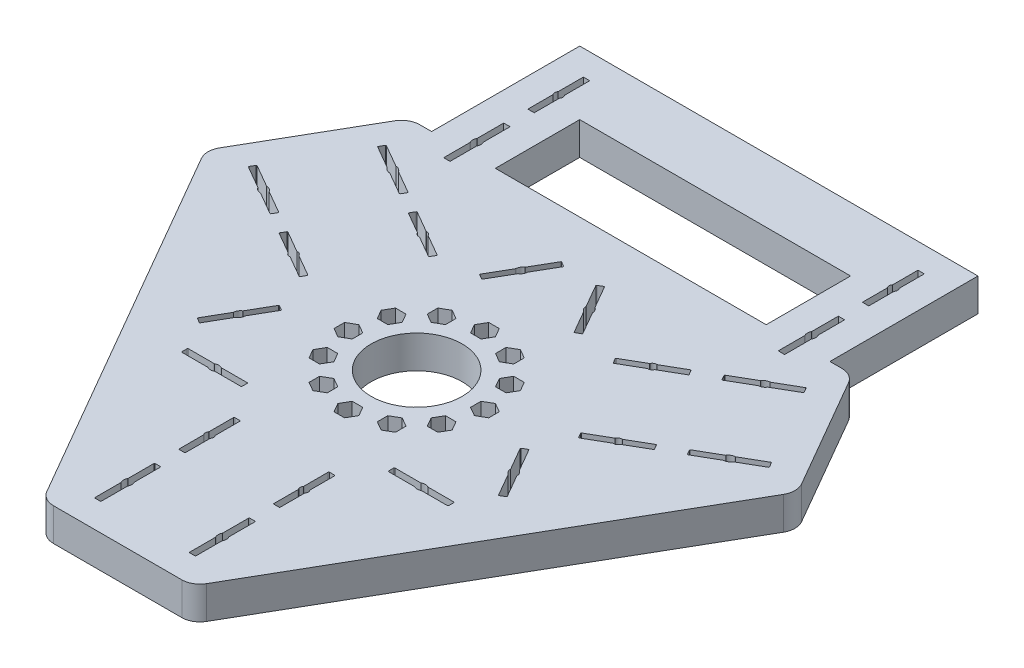
from build123d import *

# Parameters (mm, degrees)
SKETCH1_R           = 25
BOSS_EXTRUDE1_DEPTH = 18
CUT_EXTRUDE1_DEPTH  = 18
CIRPATTERN1_DEPTH   = 18
CUT_EXTRUDE2_DEPTH  = 232.935325069
FILLET1_R           = 10
BOSS_EXTRUDE2_DEPTH = 18
SKETCH4_3_W         = 3.5
SKETCH4_3_H         = 9.137041555
CUT_EXTRUDE3_DEPTH  = 18


# Read off the part's stored shape, not the designer's step: CirPattern1
with BuildPart() as part:
    # Sketch1 → Boss-Extrude1 (new body)
    # profile 1 of 4: a face of its own
    with BuildSketch(Plane(origin=(0, 0, 0), x_dir=(1, 0, 0), z_dir=(0, 1, 0))):
        Polygon((-41, -164.26), (0, -164.26), (41, -164.26), (101.876666413, -58.818520778), (162.753332826, 46.622958445), (142.253332826, 82.13), (121.753332826, 117.637041555), (-121.753332826, 117.637041555), (-142.253332826, 82.13), (-162.753332826, 46.622958445), align=None)
        with BuildLine():
            ThreePointArc((24.25, -116.61), (24.352512627, -116.362512627), (24.6, -116.26))
            Line((24.6, -116.26), (27.4, -116.26))
            ThreePointArc((27.4, -116.26), (27.647487373, -116.362512627), (27.75, -116.61))
            Line((27.75, -116.61), (27.75, -130.779459534))
            ThreePointArc((27.75, -130.779459534), (27.76155644, -130.868655705), (27.795462611, -130.951961647))
            add(Edge.make_bspline(
                [(27.795462611, -134.568038353), (28.819607586, -132.76), (27.795462611, -130.951961647)],
                knots=[4.065534334, 4.065534334, 4.065534334, 5.359243627, 5.359243627, 5.359243627], degree=2, weights=[1, 0.797983383, 1]))
            ThreePointArc((27.795462611, -134.568038353), (27.76155644, -134.651344295), (27.75, -134.740540466))
            Line((27.75, -134.740540466), (27.75, -148.91))
            ThreePointArc((27.75, -148.91), (27.647487373, -149.157487373), (27.4, -149.26))
            Line((27.4, -149.26), (24.6, -149.26))
            ThreePointArc((24.6, -149.26), (24.352512627, -149.157487373), (24.25, -148.91))
            Line((24.25, -148.91), (24.25, -134.740540466))
            ThreePointArc((24.25, -134.740540466), (24.23844356, -134.651344295), (24.204537389, -134.568038353))
            add(Edge.make_bspline(
                [(24.204537389, -130.951961647), (23.180392414, -132.76), (24.204537389, -134.568038353)],
                knots=[0.923941681, 0.923941681, 0.923941681, 2.217650973, 2.217650973, 2.217650973], degree=2, weights=[1, 0.797983383, 1]))
            ThreePointArc((24.204537389, -130.951961647), (24.23844356, -130.868655705), (24.25, -130.779459534))
            Line((24.25, -130.779459534), (24.25, -116.61))
        make_face(mode=Mode.SUBTRACT)
        with BuildLine():
            ThreePointArc((24.25, -72.86), (24.352512627, -72.612512627), (24.6, -72.51))
            Line((24.6, -72.51), (27.4, -72.51))
            ThreePointArc((27.4, -72.51), (27.647487373, -72.612512627), (27.75, -72.86))
            Line((27.75, -72.86), (27.75, -86.227029028))
            ThreePointArc((27.75, -86.227029028), (27.767252117, -86.335559421), (27.817307692, -86.433390505))
            ThreePointArc((27.817307692, -86.433390505), (28.25, -87.76), (27.817307692, -89.086609495))
            ThreePointArc((27.817307692, -89.086609495), (27.767252117, -89.184440579), (27.75, -89.292970972))
            Line((27.75, -89.292970972), (27.75, -102.66))
            ThreePointArc((27.75, -102.66), (27.647487373, -102.907487373), (27.4, -103.01))
            Line((27.4, -103.01), (24.6, -103.01))
            ThreePointArc((24.6, -103.01), (24.352512627, -102.907487373), (24.25, -102.66))
            Line((24.25, -102.66), (24.25, -89.292970972))
            ThreePointArc((24.25, -89.292970972), (24.232747883, -89.184440579), (24.182692308, -89.086609495))
            ThreePointArc((24.182692308, -89.086609495), (23.75, -87.76), (24.182692308, -86.433390505))
            ThreePointArc((24.182692308, -86.433390505), (24.232747883, -86.335559421), (24.25, -86.227029028))
            Line((24.25, -86.227029028), (24.25, -72.86))
        make_face(mode=Mode.SUBTRACT)
        with BuildLine():
            Line((72.9, -56), (58.730540466, -56))
            ThreePointArc((58.730540466, -56), (58.641344295, -56.01155644), (58.558038353, -56.045462611))
            add(Edge.make_bspline(
                [(54.941961647, -56.045462611), (56.75, -57.069607586), (58.558038353, -56.045462611)],
                knots=[4.065534334, 4.065534334, 4.065534334, 5.359243627, 5.359243627, 5.359243627], degree=2, weights=[1, 0.797983383, 1]))
            ThreePointArc((54.941961647, -56.045462611), (54.858655705, -56.01155644), (54.769459534, -56))
            Line((54.769459534, -56), (40.6, -56))
            ThreePointArc((40.6, -56), (40.352512627, -55.897487373), (40.25, -55.65))
            Line((40.25, -55.65), (40.25, -52.85))
            ThreePointArc((40.25, -52.85), (40.352512627, -52.602512627), (40.6, -52.5))
            Line((40.6, -52.5), (54.769459534, -52.5))
            ThreePointArc((54.769459534, -52.5), (54.858655705, -52.48844356), (54.941961647, -52.454537389))
            add(Edge.make_bspline(
                [(58.558038353, -52.454537389), (56.75, -51.430392414), (54.941961647, -52.454537389)],
                knots=[0.923941681, 0.923941681, 0.923941681, 2.217650973, 2.217650973, 2.217650973], degree=2, weights=[1, 0.797983383, 1]))
            ThreePointArc((58.558038353, -52.454537389), (58.641344295, -52.48844356), (58.730540466, -52.5))
            Line((58.730540466, -52.5), (72.9, -52.5))
            ThreePointArc((72.9, -52.5), (73.147487373, -52.602512627), (73.25, -52.85))
            Line((73.25, -52.85), (73.25, -55.65))
            ThreePointArc((73.25, -55.65), (73.147487373, -55.897487373), (72.9, -56))
        make_face(mode=Mode.SUBTRACT)
        with Locations(Location((0, 0, 0), (0, 0, 270))):
            Circle(SKETCH1_R, mode=Mode.SUBTRACT)
    # profile 2 of 4: a face of its own
    with BuildSketch(Plane(origin=(0, 0, 0), x_dir=(1, 0, 0), z_dir=(0, 1, 0))):
        with BuildLine():
            ThreePointArc((27.75, -86.227029028), (27.767252117, -86.335559421), (27.817307692, -86.433390505))
            ThreePointArc((27.817307692, -86.433390505), (28.25, -87.76), (27.817307692, -89.086609495))
            ThreePointArc((27.817307692, -89.086609495), (27.767252117, -89.184440579), (27.75, -89.292970972))
            Line((27.75, -89.292970972), (27.75, -102.66))
            ThreePointArc((27.75, -102.66), (27.647487373, -102.907487373), (27.4, -103.01))
            Line((27.4, -103.01), (24.6, -103.01))
            ThreePointArc((24.6, -103.01), (24.352512627, -102.907487373), (24.25, -102.66))
            Line((24.25, -102.66), (24.25, -89.292970972))
            ThreePointArc((24.25, -89.292970972), (24.232747883, -89.184440579), (24.182692308, -89.086609495))
            ThreePointArc((24.182692308, -89.086609495), (23.75, -87.76), (24.182692308, -86.433390505))
            ThreePointArc((24.182692308, -86.433390505), (24.232747883, -86.335559421), (24.25, -86.227029028))
            Line((24.25, -86.227029028), (24.25, -72.86))
            ThreePointArc((24.25, -72.86), (24.352512627, -72.612512627), (24.6, -72.51))
            Line((24.6, -72.51), (27.4, -72.51))
            ThreePointArc((27.4, -72.51), (27.647487373, -72.612512627), (27.75, -72.86))
            Line((27.75, -72.86), (27.75, -86.227029028))
        make_face()
    # profile 3 of 4: a face of its own
    with BuildSketch(Plane(origin=(0, 0, 0), x_dir=(1, 0, 0), z_dir=(0, 1, 0))):
        with BuildLine():
            ThreePointArc((24.25, -130.779459534), (24.23844356, -130.868655705), (24.204537389, -130.951961647))
            add(Edge.make_bspline(
                [(24.204537389, -130.951961647), (23.180392414, -132.76), (24.204537389, -134.568038353)],
                knots=[0.923941681, 0.923941681, 0.923941681, 2.217650973, 2.217650973, 2.217650973], degree=2, weights=[1, 0.797983383, 1]))
            ThreePointArc((24.204537389, -134.568038353), (24.23844356, -134.651344295), (24.25, -134.740540466))
            Line((24.25, -134.740540466), (24.25, -148.91))
            ThreePointArc((24.25, -148.91), (24.352512627, -149.157487373), (24.6, -149.26))
            Line((24.6, -149.26), (27.4, -149.26))
            ThreePointArc((27.4, -149.26), (27.647487373, -149.157487373), (27.75, -148.91))
            Line((27.75, -148.91), (27.75, -134.740540466))
            ThreePointArc((27.75, -134.740540466), (27.76155644, -134.651344295), (27.795462611, -134.568038353))
            add(Edge.make_bspline(
                [(27.795462611, -134.568038353), (28.819607586, -132.76), (27.795462611, -130.951961647)],
                knots=[4.065534334, 4.065534334, 4.065534334, 5.359243627, 5.359243627, 5.359243627], degree=2, weights=[1, 0.797983383, 1]))
            ThreePointArc((27.795462611, -130.951961647), (27.76155644, -130.868655705), (27.75, -130.779459534))
            Line((27.75, -130.779459534), (27.75, -116.61))
            ThreePointArc((27.75, -116.61), (27.647487373, -116.362512627), (27.4, -116.26))
            Line((27.4, -116.26), (24.6, -116.26))
            ThreePointArc((24.6, -116.26), (24.352512627, -116.362512627), (24.25, -116.61))
            Line((24.25, -116.61), (24.25, -130.779459534))
        make_face()
    # profile 4 of 4: a face of its own
    with BuildSketch(Plane(origin=(0, 0, 0), x_dir=(1, 0, 0), z_dir=(0, 1, 0))):
        with BuildLine():
            ThreePointArc((58.558038353, -56.045462611), (58.641344295, -56.01155644), (58.730540466, -56))
            Line((58.730540466, -56), (72.9, -56))
            ThreePointArc((72.9, -56), (73.147487373, -55.897487373), (73.25, -55.65))
            Line((73.25, -55.65), (73.25, -52.85))
            ThreePointArc((73.25, -52.85), (73.147487373, -52.602512627), (72.9, -52.5))
            Line((72.9, -52.5), (58.730540466, -52.5))
            ThreePointArc((58.730540466, -52.5), (58.641344295, -52.48844356), (58.558038353, -52.454537389))
            add(Edge.make_bspline(
                [(58.558038353, -52.454537389), (56.75, -51.430392414), (54.941961647, -52.454537389)],
                knots=[0.923941681, 0.923941681, 0.923941681, 2.217650973, 2.217650973, 2.217650973], degree=2, weights=[1, 0.797983383, 1]))
            ThreePointArc((54.941961647, -52.454537389), (54.858655705, -52.48844356), (54.769459534, -52.5))
            Line((54.769459534, -52.5), (40.6, -52.5))
            ThreePointArc((40.6, -52.5), (40.352512627, -52.602512627), (40.25, -52.85))
            Line((40.25, -52.85), (40.25, -55.65))
            ThreePointArc((40.25, -55.65), (40.352512627, -55.897487373), (40.6, -56))
            Line((40.6, -56), (54.769459534, -56))
            ThreePointArc((54.769459534, -56), (54.858655705, -56.01155644), (54.941961647, -56.045462611))
            add(Edge.make_bspline(
                [(54.941961647, -56.045462611), (56.75, -57.069607586), (58.558038353, -56.045462611)],
                knots=[4.065534334, 4.065534334, 4.065534334, 5.359243627, 5.359243627, 5.359243627], degree=2, weights=[1, 0.797983383, 1]))
        make_face()
    extrude(amount=BOSS_EXTRUDE1_DEPTH)

    # Sketch1<3> → Cut-Extrude1 (cut)
    with BuildSketch(Plane(origin=(0, 0, 0), x_dir=(1, 0, 0), z_dir=(0, 1, 0))):
        with BuildLine():
            Line((24.6, -72.51), (27.4, -72.51))
            ThreePointArc((27.4, -72.51), (27.647487373, -72.612512627), (27.75, -72.86))
            Line((27.75, -72.86), (27.75, -86.227029028))
            ThreePointArc((27.75, -86.227029028), (27.767252117, -86.335559421), (27.817307692, -86.433390505))
            ThreePointArc((27.817307692, -86.433390505), (28.25, -87.76), (27.817307692, -89.086609495))
            ThreePointArc((27.817307692, -89.086609495), (27.767252117, -89.184440579), (27.75, -89.292970972))
            Line((27.75, -89.292970972), (27.75, -102.66))
            ThreePointArc((27.75, -102.66), (27.647487373, -102.907487373), (27.4, -103.01))
            Line((27.4, -103.01), (24.6, -103.01))
            ThreePointArc((24.6, -103.01), (24.352512627, -102.907487373), (24.25, -102.66))
            Line((24.25, -102.66), (24.25, -89.292970972))
            ThreePointArc((24.25, -89.292970972), (24.232747883, -89.184440579), (24.182692308, -89.086609495))
            ThreePointArc((24.182692308, -89.086609495), (23.75, -87.76), (24.182692308, -86.433390505))
            ThreePointArc((24.182692308, -86.433390505), (24.232747883, -86.335559421), (24.25, -86.227029028))
            Line((24.25, -86.227029028), (24.25, -72.86))
            ThreePointArc((24.25, -72.86), (24.352512627, -72.612512627), (24.6, -72.51))
        make_face()
        with BuildLine():
            Line((24.6, -116.26), (27.4, -116.26))
            ThreePointArc((27.4, -116.26), (27.647487373, -116.362512627), (27.75, -116.61))
            Line((27.75, -116.61), (27.75, -130.779459534))
            ThreePointArc((27.75, -130.779459534), (27.76155644, -130.868655705), (27.795462611, -130.951961647))
            add(Edge.make_bspline(
                [(27.795462611, -134.568038353), (28.819607586, -132.76), (27.795462611, -130.951961647)],
                knots=[4.065534334, 4.065534334, 4.065534334, 5.359243627, 5.359243627, 5.359243627], degree=2, weights=[1, 0.797983383, 1]))
            ThreePointArc((27.795462611, -134.568038353), (27.76155644, -134.651344295), (27.75, -134.740540466))
            Line((27.75, -134.740540466), (27.75, -148.91))
            ThreePointArc((27.75, -148.91), (27.647487373, -149.157487373), (27.4, -149.26))
            Line((27.4, -149.26), (24.6, -149.26))
            ThreePointArc((24.6, -149.26), (24.352512627, -149.157487373), (24.25, -148.91))
            Line((24.25, -148.91), (24.25, -134.740540466))
            ThreePointArc((24.25, -134.740540466), (24.23844356, -134.651344295), (24.204537389, -134.568038353))
            add(Edge.make_bspline(
                [(24.204537389, -130.951961647), (23.180392414, -132.76), (24.204537389, -134.568038353)],
                knots=[0.923941681, 0.923941681, 0.923941681, 2.217650973, 2.217650973, 2.217650973], degree=2, weights=[1, 0.797983383, 1]))
            ThreePointArc((24.204537389, -130.951961647), (24.23844356, -130.868655705), (24.25, -130.779459534))
            Line((24.25, -130.779459534), (24.25, -116.61))
            ThreePointArc((24.25, -116.61), (24.352512627, -116.362512627), (24.6, -116.26))
        make_face()
        with BuildLine():
            Line((58.730540466, -56), (72.9, -56))
            ThreePointArc((72.9, -56), (73.147487373, -55.897487373), (73.25, -55.65))
            Line((73.25, -55.65), (73.25, -52.85))
            ThreePointArc((73.25, -52.85), (73.147487373, -52.602512627), (72.9, -52.5))
            Line((72.9, -52.5), (58.730540466, -52.5))
            ThreePointArc((58.730540466, -52.5), (58.641344295, -52.48844356), (58.558038353, -52.454537389))
            add(Edge.make_bspline(
                [(58.558038353, -52.454537389), (56.75, -51.430392414), (54.941961647, -52.454537389)],
                knots=[0.923941681, 0.923941681, 0.923941681, 2.217650973, 2.217650973, 2.217650973], degree=2, weights=[1, 0.797983383, 1]))
            ThreePointArc((54.941961647, -52.454537389), (54.858655705, -52.48844356), (54.769459534, -52.5))
            Line((54.769459534, -52.5), (40.6, -52.5))
            ThreePointArc((40.6, -52.5), (40.352512627, -52.602512627), (40.25, -52.85))
            Line((40.25, -52.85), (40.25, -55.65))
            ThreePointArc((40.25, -55.65), (40.352512627, -55.897487373), (40.6, -56))
            Line((40.6, -56), (54.769459534, -56))
            ThreePointArc((54.769459534, -56), (54.858655705, -56.01155644), (54.941961647, -56.045462611))
            add(Edge.make_bspline(
                [(54.941961647, -56.045462611), (56.75, -57.069607586), (58.558038353, -56.045462611)],
                knots=[4.065534334, 4.065534334, 4.065534334, 5.359243627, 5.359243627, 5.359243627], degree=2, weights=[1, 0.797983383, 1]))
            ThreePointArc((58.558038353, -56.045462611), (58.641344295, -56.01155644), (58.730540466, -56))
        make_face()
    cut_extrude1 = extrude(amount=CUT_EXTRUDE1_DEPTH, mode=Mode.SUBTRACT)

    # Mirror1: Cut-Extrude1 across plane
    add(cut_extrude1.mirror(Plane(origin=(0, 0, 0), x_dir=(0, 0, 1), z_dir=(1, 0, 0))), mode=Mode.SUBTRACT)

    # CirPattern1 outline → CirPattern1 (cut)
    with BuildSketch(Plane(origin=(0, 0, 0), x_dir=(1, 0, 0), z_dir=(0, 1, 0))):
        with BuildLine():
            ThreePointArc((101.13333425, 86.390845809), (101.21635862, 86.425435723), (101.305456767, 86.437725089))
            add(Edge.make_bspline(
                [(101.305456767, 86.437725089), (103.3833364, 86.4548087), (104.437071057, 88.245763442)],
                knots=[0.923941681, 0.923941681, 0.923941681, 2.217650973, 2.217650973, 2.217650973], degree=2, weights=[1, 0.797983383, 1]))
            ThreePointArc((104.437071057, 88.245763442), (104.492263033, 88.316780018), (104.563730963, 88.371386275))
            Line((104.563730963, 88.371386275), (116.834842878, 95.456116042))
            ThreePointArc((116.834842878, 95.456116042), (116.997916917, 95.668638267), (116.962951769, 95.934224933))
            Line((116.962951769, 95.934224933), (115.562951769, 98.359096064))
            ThreePointArc((115.562951769, 98.359096064), (115.350429544, 98.522170103), (115.084842878, 98.487204955))
            Line((115.084842878, 98.487204955), (102.813730963, 91.402475188))
            ThreePointArc((102.813730963, 91.402475188), (102.730706592, 91.367885273), (102.641608445, 91.355595908))
            add(Edge.make_bspline(
                [(102.641608445, 91.355595908), (100.563728813, 91.338512297), (99.509994156, 89.547557555)],
                knots=[4.065534334, 4.065534334, 4.065534334, 5.359243627, 5.359243627, 5.359243627], degree=2, weights=[1, 0.797983383, 1]))
            ThreePointArc((99.509994156, 89.547557555), (99.45480218, 89.476540979), (99.38333425, 89.421934722))
            Line((99.38333425, 89.421934722), (87.112222335, 82.337204955))
            ThreePointArc((87.112222335, 82.337204955), (86.949148296, 82.12468273), (86.984113444, 81.859096064))
            Line((86.984113444, 81.859096064), (88.384113444, 79.434224933))
            ThreePointArc((88.384113444, 79.434224933), (88.596635669, 79.271150894), (88.862222335, 79.306116042))
            Line((88.862222335, 79.306116042), (101.13333425, 86.390845809))
        make_face()
        with BuildLine():
            ThreePointArc((16.101063466, 77.112140022), (16.13565338, 77.029115651), (16.147942746, 76.940017504))
            add(Edge.make_bspline(
                [(16.147942746, 76.940017504), (16.165026357, 74.862137872), (17.955981099, 73.808403214)],
                knots=[0.923941681, 0.923941681, 0.923941681, 2.217650973, 2.217650973, 2.217650973], degree=2, weights=[1, 0.797983383, 1]))
            ThreePointArc((17.955981099, 73.808403214), (18.026997675, 73.753211238), (18.081603932, 73.681743308))
            Line((18.081603932, 73.681743308), (25.166333699, 61.410631394))
            ThreePointArc((25.166333699, 61.410631394), (25.378855924, 61.247557354), (25.64444259, 61.282522502))
            Line((25.64444259, 61.282522502), (28.069313721, 62.682522502))
            ThreePointArc((28.069313721, 62.682522502), (28.23238776, 62.895044728), (28.197422612, 63.160631394))
            Line((28.197422612, 63.160631394), (21.112692845, 75.431743308))
            ThreePointArc((21.112692845, 75.431743308), (21.07810293, 75.514767679), (21.065813565, 75.603865826))
            add(Edge.make_bspline(
                [(19.257775212, 78.735480115), (21.048729954, 77.681745458), (21.065813565, 75.603865826)],
                knots=[0.923941681, 0.923941681, 0.923941681, 2.217650973, 2.217650973, 2.217650973], degree=2, weights=[1, 0.797983383, 1]))
            ThreePointArc((19.257775212, 78.735480115), (19.186758636, 78.790672091), (19.132152379, 78.862140022))
            Line((19.132152379, 78.862140022), (12.047422612, 91.133251936))
            ThreePointArc((12.047422612, 91.133251936), (11.834900387, 91.296325975), (11.569313721, 91.261360827))
            Line((11.569313721, 91.261360827), (9.14444259, 89.861360827))
            ThreePointArc((9.14444259, 89.861360827), (8.981368551, 89.648838602), (9.016333699, 89.383251936))
            Line((9.016333699, 89.383251936), (16.101063466, 77.112140022))
        make_face()
        with BuildLine():
            ThreePointArc((-125.38333425, 44.388613725), (-125.45480218, 44.443219982), (-125.509994156, 44.514236558))
            add(Edge.make_bspline(
                [(-125.509994156, 44.514236558), (-126.563728813, 46.3051913), (-128.641608445, 46.322274911)],
                knots=[0.923941681, 0.923941681, 0.923941681, 2.217650973, 2.217650973, 2.217650973], degree=2, weights=[1, 0.797983383, 1]))
            ThreePointArc((-128.641608445, 46.322274911), (-128.730706592, 46.334564277), (-128.813730963, 46.369154191))
            Line((-128.813730963, 46.369154191), (-141.084842878, 53.453883958))
            ThreePointArc((-141.084842878, 53.453883958), (-141.350429544, 53.488849106), (-141.562951769, 53.325775067))
            Line((-141.562951769, 53.325775067), (-142.962951769, 50.900903936))
            ThreePointArc((-142.962951769, 50.900903936), (-142.997916917, 50.63531727), (-142.834842878, 50.422795045))
            Line((-142.834842878, 50.422795045), (-130.563730963, 43.338065278))
            ThreePointArc((-130.563730963, 43.338065278), (-130.492263033, 43.283459021), (-130.437071057, 43.212442445))
            add(Edge.make_bspline(
                [(-130.437071057, 43.212442445), (-129.3833364, 41.421487703), (-127.305456767, 41.404404092)],
                knots=[4.065534334, 4.065534334, 4.065534334, 5.359243627, 5.359243627, 5.359243627], degree=2, weights=[1, 0.797983383, 1]))
            ThreePointArc((-127.305456767, 41.404404092), (-127.21635862, 41.392114727), (-127.13333425, 41.357524812))
            Line((-127.13333425, 41.357524812), (-114.862222335, 34.272795045))
            ThreePointArc((-114.862222335, 34.272795045), (-114.596635669, 34.237829897), (-114.384113444, 34.400903936))
            Line((-114.384113444, 34.400903936), (-112.984113444, 36.825775067))
            ThreePointArc((-112.984113444, 36.825775067), (-112.949148296, 37.091361733), (-113.112222335, 37.303883958))
            Line((-113.112222335, 37.303883958), (-125.38333425, 44.388613725))
        make_face()
        with BuildLine():
            ThreePointArc((-74.831603932, -24.612140022), (-74.776997675, -24.540672091), (-74.705981099, -24.485480115))
            add(Edge.make_bspline(
                [(-74.705981099, -24.485480115), (-72.915026357, -23.431745458), (-72.897942746, -21.353865826)],
                knots=[0.923941681, 0.923941681, 0.923941681, 2.217650973, 2.217650973, 2.217650973], degree=2, weights=[1, 0.797983383, 1]))
            ThreePointArc((-72.897942746, -21.353865826), (-72.88565338, -21.264767679), (-72.851063466, -21.181743308))
            Line((-72.851063466, -21.181743308), (-65.766333699, -8.910631394))
            ThreePointArc((-65.766333699, -8.910631394), (-65.731368551, -8.645044728), (-65.89444259, -8.432522502))
            Line((-65.89444259, -8.432522502), (-68.319313721, -7.032522502))
            ThreePointArc((-68.319313721, -7.032522502), (-68.584900387, -6.997557354), (-68.797422612, -7.160631394))
            Line((-68.797422612, -7.160631394), (-75.882152379, -19.431743308))
            ThreePointArc((-75.882152379, -19.431743308), (-75.936758636, -19.503211238), (-76.007775212, -19.558403214))
            add(Edge.make_bspline(
                [(-77.815813565, -22.690017504), (-77.798729954, -20.612137872), (-76.007775212, -19.558403214)],
                knots=[0.923941681, 0.923941681, 0.923941681, 2.217650973, 2.217650973, 2.217650973], degree=2, weights=[1, 0.797983383, 1]))
            ThreePointArc((-77.815813565, -22.690017504), (-77.82810293, -22.779115651), (-77.862692845, -22.862140022))
            Line((-77.862692845, -22.862140022), (-84.947422612, -35.133251936))
            ThreePointArc((-84.947422612, -35.133251936), (-84.98238776, -35.398838602), (-84.819313721, -35.611360827))
            Line((-84.819313721, -35.611360827), (-82.39444259, -37.011360827))
            ThreePointArc((-82.39444259, -37.011360827), (-82.128855924, -37.046325975), (-81.916333699, -36.883251936))
            Line((-81.916333699, -36.883251936), (-74.831603932, -24.612140022))
        make_face()
        with BuildLine():
            add(Edge.make_bspline(
                [(130.437071057, 43.212442445), (129.3833364, 41.421487703), (127.305456767, 41.404404092)],
                knots=[4.065534334, 4.065534334, 4.065534334, 5.359243627, 5.359243627, 5.359243627], degree=2, weights=[1, 0.797983383, 1]))
            ThreePointArc((130.437071057, 43.212442445), (130.492263033, 43.283459021), (130.563730963, 43.338065278))
            Line((130.563730963, 43.338065278), (142.834842878, 50.422795045))
            ThreePointArc((142.834842878, 50.422795045), (142.997916917, 50.63531727), (142.962951769, 50.900903936))
            Line((142.962951769, 50.900903936), (141.562951769, 53.325775067))
            ThreePointArc((141.562951769, 53.325775067), (141.350429544, 53.488849106), (141.084842878, 53.453883958))
            Line((141.084842878, 53.453883958), (128.813730963, 46.369154191))
            ThreePointArc((128.813730963, 46.369154191), (128.730706592, 46.334564277), (128.641608445, 46.322274911))
            add(Edge.make_bspline(
                [(125.509994156, 44.514236558), (126.563728813, 46.3051913), (128.641608445, 46.322274911)],
                knots=[0.923941681, 0.923941681, 0.923941681, 2.217650973, 2.217650973, 2.217650973], degree=2, weights=[1, 0.797983383, 1]))
            ThreePointArc((125.509994156, 44.514236558), (125.45480218, 44.443219982), (125.38333425, 44.388613725))
            Line((125.38333425, 44.388613725), (113.112222335, 37.303883958))
            ThreePointArc((113.112222335, 37.303883958), (112.949148296, 37.091361733), (112.984113444, 36.825775067))
            Line((112.984113444, 36.825775067), (114.384113444, 34.400903936))
            ThreePointArc((114.384113444, 34.400903936), (114.596635669, 34.237829897), (114.862222335, 34.272795045))
            Line((114.862222335, 34.272795045), (127.13333425, 41.357524812))
            ThreePointArc((127.13333425, 41.357524812), (127.21635862, 41.392114727), (127.305456767, 41.404404092))
        make_face()
        with BuildLine():
            ThreePointArc((77.862692845, -22.862140022), (77.82810293, -22.779115651), (77.815813565, -22.690017504))
            add(Edge.make_bspline(
                [(77.815813565, -22.690017504), (77.798729954, -20.612137872), (76.007775212, -19.558403214)],
                knots=[0.923941681, 0.923941681, 0.923941681, 2.217650973, 2.217650973, 2.217650973], degree=2, weights=[1, 0.797983383, 1]))
            ThreePointArc((76.007775212, -19.558403214), (75.936758636, -19.503211238), (75.882152379, -19.431743308))
            Line((75.882152379, -19.431743308), (68.797422612, -7.160631394))
            ThreePointArc((68.797422612, -7.160631394), (68.584900387, -6.997557354), (68.319313721, -7.032522502))
            Line((68.319313721, -7.032522502), (65.89444259, -8.432522502))
            ThreePointArc((65.89444259, -8.432522502), (65.731368551, -8.645044728), (65.766333699, -8.910631394))
            Line((65.766333699, -8.910631394), (72.851063466, -21.181743308))
            ThreePointArc((72.851063466, -21.181743308), (72.88565338, -21.264767679), (72.897942746, -21.353865826))
            add(Edge.make_bspline(
                [(74.705981099, -24.485480115), (72.915026357, -23.431745458), (72.897942746, -21.353865826)],
                knots=[0.923941681, 0.923941681, 0.923941681, 2.217650973, 2.217650973, 2.217650973], degree=2, weights=[1, 0.797983383, 1]))
            ThreePointArc((74.705981099, -24.485480115), (74.776997675, -24.540672091), (74.831603932, -24.612140022))
            Line((74.831603932, -24.612140022), (81.916333699, -36.883251936))
            ThreePointArc((81.916333699, -36.883251936), (82.128855924, -37.046325975), (82.39444259, -37.011360827))
            Line((82.39444259, -37.011360827), (84.819313721, -35.611360827))
            ThreePointArc((84.819313721, -35.611360827), (84.98238776, -35.398838602), (84.947422612, -35.133251936))
            Line((84.947422612, -35.133251936), (77.862692845, -22.862140022))
        make_face()
        with BuildLine():
            add(Edge.make_bspline(
                [(-102.641608445, 91.355595908), (-100.563728813, 91.338512297), (-99.509994156, 89.547557555)],
                knots=[4.065534334, 4.065534334, 4.065534334, 5.359243627, 5.359243627, 5.359243627], degree=2, weights=[1, 0.797983383, 1]))
            ThreePointArc((-102.641608445, 91.355595908), (-102.730706592, 91.367885273), (-102.813730963, 91.402475188))
            Line((-102.813730963, 91.402475188), (-115.084842878, 98.487204955))
            ThreePointArc((-115.084842878, 98.487204955), (-115.350429544, 98.522170103), (-115.562951769, 98.359096064))
            Line((-115.562951769, 98.359096064), (-116.962951769, 95.934224933))
            ThreePointArc((-116.962951769, 95.934224933), (-116.997916917, 95.668638267), (-116.834842878, 95.456116042))
            Line((-116.834842878, 95.456116042), (-104.563730963, 88.371386275))
            ThreePointArc((-104.563730963, 88.371386275), (-104.492263033, 88.316780018), (-104.437071057, 88.245763442))
            add(Edge.make_bspline(
                [(-101.305456767, 86.437725089), (-103.3833364, 86.4548087), (-104.437071057, 88.245763442)],
                knots=[0.923941681, 0.923941681, 0.923941681, 2.217650973, 2.217650973, 2.217650973], degree=2, weights=[1, 0.797983383, 1]))
            ThreePointArc((-101.305456767, 86.437725089), (-101.21635862, 86.425435723), (-101.13333425, 86.390845809))
            Line((-101.13333425, 86.390845809), (-88.862222335, 79.306116042))
            ThreePointArc((-88.862222335, 79.306116042), (-88.596635669, 79.271150894), (-88.384113444, 79.434224933))
            Line((-88.384113444, 79.434224933), (-86.984113444, 81.859096064))
            ThreePointArc((-86.984113444, 81.859096064), (-86.949148296, 82.12468273), (-87.112222335, 82.337204955))
            Line((-87.112222335, 82.337204955), (-99.38333425, 89.421934722))
            ThreePointArc((-99.38333425, 89.421934722), (-99.45480218, 89.476540979), (-99.509994156, 89.547557555))
        make_face()
        with BuildLine():
            ThreePointArc((-19.132152379, 78.862140022), (-19.186758636, 78.790672091), (-19.257775212, 78.735480115))
            add(Edge.make_bspline(
                [(-19.257775212, 78.735480115), (-21.048729954, 77.681745458), (-21.065813565, 75.603865826)],
                knots=[0.923941681, 0.923941681, 0.923941681, 2.217650973, 2.217650973, 2.217650973], degree=2, weights=[1, 0.797983383, 1]))
            ThreePointArc((-21.065813565, 75.603865826), (-21.07810293, 75.514767679), (-21.112692845, 75.431743308))
            Line((-21.112692845, 75.431743308), (-28.197422612, 63.160631394))
            ThreePointArc((-28.197422612, 63.160631394), (-28.23238776, 62.895044728), (-28.069313721, 62.682522502))
            Line((-28.069313721, 62.682522502), (-25.64444259, 61.282522502))
            ThreePointArc((-25.64444259, 61.282522502), (-25.378855924, 61.247557354), (-25.166333699, 61.410631394))
            Line((-25.166333699, 61.410631394), (-18.081603932, 73.681743308))
            ThreePointArc((-18.081603932, 73.681743308), (-18.026997675, 73.753211238), (-17.955981099, 73.808403214))
            add(Edge.make_bspline(
                [(-16.147942746, 76.940017504), (-16.165026357, 74.862137872), (-17.955981099, 73.808403214)],
                knots=[0.923941681, 0.923941681, 0.923941681, 2.217650973, 2.217650973, 2.217650973], degree=2, weights=[1, 0.797983383, 1]))
            ThreePointArc((-16.147942746, 76.940017504), (-16.13565338, 77.029115651), (-16.101063466, 77.112140022))
            Line((-16.101063466, 77.112140022), (-9.016333699, 89.383251936))
            ThreePointArc((-9.016333699, 89.383251936), (-8.981368551, 89.648838602), (-9.14444259, 89.861360827))
            Line((-9.14444259, 89.861360827), (-11.569313721, 91.261360827))
            ThreePointArc((-11.569313721, 91.261360827), (-11.834900387, 91.296325975), (-12.047422612, 91.133251936))
            Line((-12.047422612, 91.133251936), (-19.132152379, 78.862140022))
        make_face()
        with BuildLine():
            Line((50.97361092, 57.431116042), (62.549797631, 64.114630556))
            ThreePointArc((62.549797631, 64.114630556), (62.652413767, 64.153954981), (62.762165759, 64.159521123))
            ThreePointArc((62.762165759, 64.159521123), (64.127389436, 64.44810334), (65.059920806, 65.486130618))
            ThreePointArc((65.059920806, 65.486130618), (65.119617222, 65.57839556), (65.204981241, 65.647601528))
            Line((65.204981241, 65.647601528), (76.781167953, 72.331116042))
            ThreePointArc((76.781167953, 72.331116042), (76.944241992, 72.543638267), (76.909276844, 72.809224933))
            Line((76.909276844, 72.809224933), (75.509276844, 75.234096064))
            ThreePointArc((75.509276844, 75.234096064), (75.296754619, 75.397170103), (75.031167953, 75.362204955))
            Line((75.031167953, 75.362204955), (63.454981241, 68.678690441))
            ThreePointArc((63.454981241, 68.678690441), (63.352365105, 68.639366016), (63.242613113, 68.633799874))
            ThreePointArc((63.242613113, 68.633799874), (61.877389436, 68.345217657), (60.944858067, 67.307190379))
            ThreePointArc((60.944858067, 67.307190379), (60.88516165, 67.214925437), (60.799797631, 67.145719469))
            Line((60.799797631, 67.145719469), (49.22361092, 60.462204955))
            ThreePointArc((49.22361092, 60.462204955), (49.060536881, 60.24968273), (49.095502028, 59.984096064))
            Line((49.095502028, 59.984096064), (50.495502028, 57.559224933))
            ThreePointArc((50.495502028, 57.559224933), (50.708024254, 57.396150894), (50.97361092, 57.431116042))
        make_face()
        with BuildLine():
            Line((75.095502028, 14.950775067), (76.495502028, 12.525903936))
            ThreePointArc((76.495502028, 12.525903936), (76.708024254, 12.362829897), (76.97361092, 12.397795045))
            Line((76.97361092, 12.397795045), (88.549797631, 19.081309559))
            ThreePointArc((88.549797631, 19.081309559), (88.652413767, 19.120633984), (88.762165759, 19.126200126))
            ThreePointArc((88.762165759, 19.126200126), (90.127389436, 19.414782343), (91.059920806, 20.452809621))
            ThreePointArc((91.059920806, 20.452809621), (91.119617222, 20.545074563), (91.204981241, 20.614280531))
            Line((91.204981241, 20.614280531), (102.781167953, 27.297795045))
            ThreePointArc((102.781167953, 27.297795045), (102.944241992, 27.51031727), (102.909276844, 27.775903936))
            Line((102.909276844, 27.775903936), (101.509276844, 30.200775067))
            ThreePointArc((101.509276844, 30.200775067), (101.296754619, 30.363849106), (101.031167953, 30.328883958))
            Line((101.031167953, 30.328883958), (89.454981241, 23.645369444))
            ThreePointArc((89.454981241, 23.645369444), (89.352365105, 23.606045019), (89.242613113, 23.600478877))
            ThreePointArc((89.242613113, 23.600478877), (87.877389436, 23.31189666), (86.944858067, 22.273869382))
            ThreePointArc((86.944858067, 22.273869382), (86.88516165, 22.18160444), (86.799797631, 22.112398472))
            Line((86.799797631, 22.112398472), (75.22361092, 15.428883958))
            ThreePointArc((75.22361092, 15.428883958), (75.060536881, 15.216361733), (75.095502028, 14.950775067))
        make_face()
        with BuildLine():
            Line((-75.22361092, 15.428883958), (-86.799797631, 22.112398472))
            ThreePointArc((-86.799797631, 22.112398472), (-86.88516165, 22.18160444), (-86.944858067, 22.273869382))
            ThreePointArc((-86.944858067, 22.273869382), (-87.877389436, 23.31189666), (-89.242613113, 23.600478877))
            ThreePointArc((-89.242613113, 23.600478877), (-89.352365105, 23.606045019), (-89.454981241, 23.645369444))
            Line((-89.454981241, 23.645369444), (-101.031167953, 30.328883958))
            ThreePointArc((-101.031167953, 30.328883958), (-101.296754619, 30.363849106), (-101.509276844, 30.200775067))
            Line((-101.509276844, 30.200775067), (-102.909276844, 27.775903936))
            ThreePointArc((-102.909276844, 27.775903936), (-102.944241992, 27.51031727), (-102.781167953, 27.297795045))
            Line((-102.781167953, 27.297795045), (-91.204981241, 20.614280531))
            ThreePointArc((-91.204981241, 20.614280531), (-91.119617222, 20.545074563), (-91.059920806, 20.452809621))
            ThreePointArc((-91.059920806, 20.452809621), (-90.127389436, 19.414782343), (-88.762165759, 19.126200126))
            ThreePointArc((-88.762165759, 19.126200126), (-88.652413767, 19.120633984), (-88.549797631, 19.081309559))
            Line((-88.549797631, 19.081309559), (-76.97361092, 12.397795045))
            ThreePointArc((-76.97361092, 12.397795045), (-76.708024254, 12.362829897), (-76.495502028, 12.525903936))
            Line((-76.495502028, 12.525903936), (-75.095502028, 14.950775067))
            ThreePointArc((-75.095502028, 14.950775067), (-75.060536881, 15.216361733), (-75.22361092, 15.428883958))
        make_face()
        with BuildLine():
            Line((-50.495502028, 57.559224933), (-49.095502028, 59.984096064))
            ThreePointArc((-49.095502028, 59.984096064), (-49.060536881, 60.24968273), (-49.22361092, 60.462204955))
            Line((-49.22361092, 60.462204955), (-60.799797631, 67.145719469))
            ThreePointArc((-60.799797631, 67.145719469), (-60.88516165, 67.214925437), (-60.944858067, 67.307190379))
            ThreePointArc((-60.944858067, 67.307190379), (-61.877389436, 68.345217657), (-63.242613113, 68.633799874))
            ThreePointArc((-63.242613113, 68.633799874), (-63.352365105, 68.639366016), (-63.454981241, 68.678690441))
            Line((-63.454981241, 68.678690441), (-75.031167953, 75.362204955))
            ThreePointArc((-75.031167953, 75.362204955), (-75.296754619, 75.397170103), (-75.509276844, 75.234096064))
            Line((-75.509276844, 75.234096064), (-76.909276844, 72.809224933))
            ThreePointArc((-76.909276844, 72.809224933), (-76.944241992, 72.543638267), (-76.781167953, 72.331116042))
            Line((-76.781167953, 72.331116042), (-65.204981241, 65.647601528))
            ThreePointArc((-65.204981241, 65.647601528), (-65.119617222, 65.57839556), (-65.059920806, 65.486130618))
            ThreePointArc((-65.059920806, 65.486130618), (-64.127389436, 64.44810334), (-62.762165759, 64.159521123))
            ThreePointArc((-62.762165759, 64.159521123), (-62.652413767, 64.153954981), (-62.549797631, 64.114630556))
            Line((-62.549797631, 64.114630556), (-50.97361092, 57.431116042))
            ThreePointArc((-50.97361092, 57.431116042), (-50.708024254, 57.396150894), (-50.495502028, 57.559224933))
        make_face()
    extrude(amount=CIRPATTERN1_DEPTH, mode=Mode.SUBTRACT)

    # Sketch3 → Cut-Extrude2 (cut, through all)
    with BuildSketch(Plane(origin=(0, 18, 0), x_dir=(1, 0, 0), z_dir=(0, 1, 0))):
        Polygon((13.75, 29.589201296), (18.75, 26.70244995), (23.75, 29.589201296), (23.75, 35.362703988), (18.75, 38.249455334), (13.75, 35.362703988), align=None)
        Polygon((2.886751346, 32.5), (5.773502692, 37.5), (2.886751346, 42.5), (-2.886751346, 42.5), (-5.773502692, 37.5), (-2.886751346, 32.5), align=None)
        Polygon((26.70244995, 18.75), (29.589201296, 13.75), (35.362703988, 13.75), (38.249455334, 18.75), (35.362703988, 23.75), (29.589201296, 23.75), align=None)
        Polygon((32.5, 2.886751346), (32.5, -2.886751346), (37.5, -5.773502692), (42.5, -2.886751346), (42.5, 2.886751346), (37.5, 5.773502692), align=None)
        Polygon((29.589201296, -13.75), (26.70244995, -18.75), (29.589201296, -23.75), (35.362703988, -23.75), (38.249455334, -18.75), (35.362703988, -13.75), align=None)
        Polygon((18.75, -26.70244995), (13.75, -29.589201296), (13.75, -35.362703988), (18.75, -38.249455334), (23.75, -35.362703988), (23.75, -29.589201296), align=None)
        Polygon((2.886751346, -32.5), (-2.886751346, -32.5), (-5.773502692, -37.5), (-2.886751346, -42.5), (2.886751346, -42.5), (5.773502692, -37.5), align=None)
        Polygon((-13.75, -29.589201296), (-18.75, -26.70244995), (-23.75, -29.589201296), (-23.75, -35.362703988), (-18.75, -38.249455334), (-13.75, -35.362703988), align=None)
        Polygon((-26.70244995, -18.75), (-29.589201296, -13.75), (-35.362703988, -13.75), (-38.249455334, -18.75), (-35.362703988, -23.75), (-29.589201296, -23.75), align=None)
        Polygon((-32.5, -2.886751346), (-32.5, 2.886751346), (-37.5, 5.773502692), (-42.5, 2.886751346), (-42.5, -2.886751346), (-37.5, -5.773502692), align=None)
        Polygon((-29.589201296, 13.75), (-26.70244995, 18.75), (-29.589201296, 23.75), (-35.362703988, 23.75), (-38.249455334, 18.75), (-35.362703988, 13.75), align=None)
        Polygon((-18.75, 26.70244995), (-13.75, 29.589201296), (-13.75, 35.362703988), (-18.75, 38.249455334), (-23.75, 35.362703988), (-23.75, 29.589201296), align=None)
    extrude(amount=-CUT_EXTRUDE2_DEPTH, mode=Mode.SUBTRACT)

    # Fillet1
    fillet1_edges = [part.edges().sort_by_distance(p)[0] for p in [
        (-121.753332826, 9, -117.637041555),
        (121.753332826, 9, -117.637041555),
        (162.753332826, 9, -46.622958445),
        (41, 9, 164.26),
        (-41, 9, 164.26),
        (-162.753332826, 9, -46.622958445),
    ]]
    fillet(fillet1_edges, radius=FILLET1_R)

    # Sketch4 → Boss-Extrude2 (add)
    with BuildSketch(Plane(origin=(0, 0, 0), x_dir=(1, 0, 0), z_dir=(0, 1, 0))):
        with BuildLine():
            Line((109.4, 199), (-109.4, 199))
            Line((-109.4, 199), (-109.4, 117.637041555))
            Line((-109.4, 117.637041555), (-93.65, 117.637041555))
            Line((-93.65, 117.637041555), (-93.65, 123.019459534))
            ThreePointArc((-93.65, 123.019459534), (-93.66155644, 123.108655705), (-93.695462611, 123.191961647))
            add(Edge.make_bspline(
                [(-93.695462611, 126.808038353), (-94.719607586, 125), (-93.695462611, 123.191961647)],
                knots=[0.923941681, 0.923941681, 0.923941681, 2.217650973, 2.217650973, 2.217650973], degree=2, weights=[1, 0.797983383, 1]))
            ThreePointArc((-93.695462611, 126.808038353), (-93.66155644, 126.891344295), (-93.65, 126.980540466))
            Line((-93.65, 126.980540466), (-93.65, 141.5))
            Line((-93.65, 141.5), (-90.15, 141.5))
            Line((-90.15, 141.5), (-90.15, 126.980540466))
            ThreePointArc((-90.15, 126.980540466), (-90.13844356, 126.891344295), (-90.104537389, 126.808038353))
            add(Edge.make_bspline(
                [(-90.104537389, 123.191961647), (-89.080392414, 125), (-90.104537389, 126.808038353)],
                knots=[4.065534334, 4.065534334, 4.065534334, 5.359243627, 5.359243627, 5.359243627], degree=2, weights=[1, 0.797983383, 1]))
            ThreePointArc((-90.104537389, 123.191961647), (-90.13844356, 123.108655705), (-90.15, 123.019459534))
            Line((-90.15, 123.019459534), (-90.15, 117.637041555))
            Line((-90.15, 117.637041555), (-74.4, 117.637041555))
            Line((-74.4, 117.637041555), (-74.4, 164))
            Line((-74.4, 164), (74.4, 164))
            Line((74.4, 164), (74.4, 117.637041555))
            Line((74.4, 117.637041555), (90.15, 117.637041555))
            Line((90.15, 117.637041555), (90.15, 123.019459534))
            ThreePointArc((90.15, 123.019459534), (90.13844356, 123.108655705), (90.104537389, 123.191961647))
            add(Edge.make_bspline(
                [(90.104537389, 126.808038353), (89.080392414, 125), (90.104537389, 123.191961647)],
                knots=[0.923941681, 0.923941681, 0.923941681, 2.217650973, 2.217650973, 2.217650973], degree=2, weights=[1, 0.797983383, 1]))
            ThreePointArc((90.104537389, 126.808038353), (90.13844356, 126.891344295), (90.15, 126.980540466))
            Line((90.15, 126.980540466), (90.15, 141.5))
            Line((90.15, 141.5), (93.65, 141.5))
            Line((93.65, 141.5), (93.65, 126.980540466))
            ThreePointArc((93.65, 126.980540466), (93.66155644, 126.891344295), (93.695462611, 126.808038353))
            add(Edge.make_bspline(
                [(93.695462611, 123.191961647), (94.719607586, 125), (93.695462611, 126.808038353)],
                knots=[4.065534334, 4.065534334, 4.065534334, 5.359243627, 5.359243627, 5.359243627], degree=2, weights=[1, 0.797983383, 1]))
            ThreePointArc((93.695462611, 123.191961647), (93.66155644, 123.108655705), (93.65, 123.019459534))
            Line((93.65, 123.019459534), (93.65, 117.637041555))
            Line((93.65, 117.637041555), (109.4, 117.637041555))
            Line((109.4, 117.637041555), (109.4, 199))
        make_face()
        with BuildLine():
            Line((-93.65, 154.75), (-93.65, 168.585786438))
            ThreePointArc((-93.65, 168.585786438), (-94.15, 170), (-93.65, 171.414213562))
            Line((-93.65, 171.414213562), (-93.65, 185.25))
            Line((-93.65, 185.25), (-90.15, 185.25))
            Line((-90.15, 185.25), (-90.15, 171.414213562))
            ThreePointArc((-90.15, 171.414213562), (-89.65, 170), (-90.15, 168.585786438))
            Line((-90.15, 168.585786438), (-90.15, 154.75))
            Line((-90.15, 154.75), (-93.65, 154.75))
        make_face(mode=Mode.SUBTRACT)
        with BuildLine():
            Line((90.15, 171.414213562), (90.15, 185.25))
            Line((90.15, 185.25), (93.65, 185.25))
            Line((93.65, 185.25), (93.65, 171.414213562))
            ThreePointArc((93.65, 171.414213562), (94.15, 170), (93.65, 168.585786438))
            Line((93.65, 168.585786438), (93.65, 154.75))
            Line((93.65, 154.75), (90.15, 154.75))
            Line((90.15, 154.75), (90.15, 168.585786438))
            ThreePointArc((90.15, 168.585786438), (89.65, 170), (90.15, 171.414213562))
        make_face(mode=Mode.SUBTRACT)
    extrude(amount=BOSS_EXTRUDE2_DEPTH)

    # Sketch4<3> → Cut-Extrude3 (cut)
    with BuildSketch(Plane(origin=(0, 0, 0), x_dir=(1, 0, 0), z_dir=(0, 1, 0))):
        with Locations((-91.9, 113.068520777)):
            Rectangle(SKETCH4_3_W, SKETCH4_3_H)
        with Locations((91.9, 113.068520777)):
            Rectangle(SKETCH4_3_W, SKETCH4_3_H)
    extrude(amount=CUT_EXTRUDE3_DEPTH, mode=Mode.SUBTRACT)


solid = part.part
